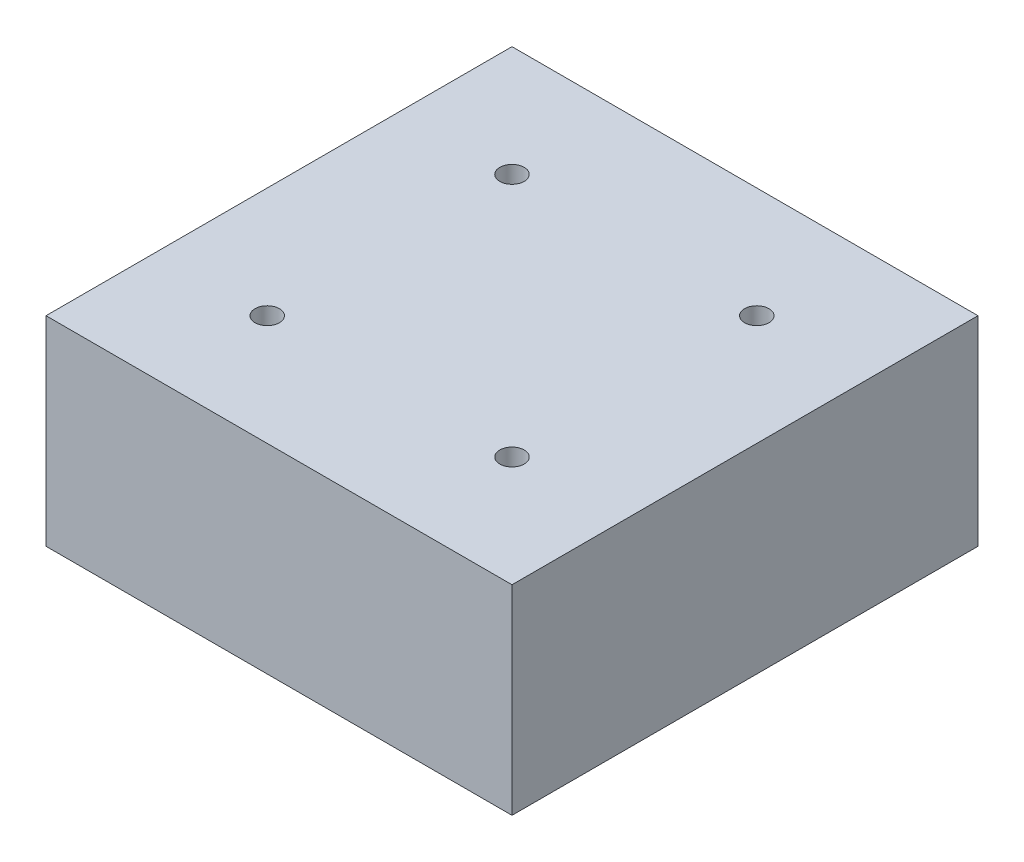
from build123d import *

# Parameters (mm, degrees)
F_01_HOUSING_PROFILE_W        = 210
F_01_HOUSING_PROFILE_H        = 210
F_01_HOUSING_PROFILE_R        = 5.5
F_01_HOUSING_BLOCK_DEPTH      = 90
F_02_FACE_BOSS_PROFILE_R      = 72.5
F_02_FACE_LOCATING_BOSS_DEPTH = 90


with BuildPart() as part:
    # 01_Housing_Profile → 01_Housing_Block (new body)
    with BuildSketch(Plane(origin=(0, 0, 0), x_dir=(1, 0, 0), z_dir=(0, 1, 0))):
        Rectangle(F_01_HOUSING_PROFILE_W, F_01_HOUSING_PROFILE_H)
        with Locations((55.154328933, 55.154328933)):
            Circle(F_01_HOUSING_PROFILE_R, mode=Mode.SUBTRACT)
        with Locations((-55.154328933, 55.154328933)):
            Circle(F_01_HOUSING_PROFILE_R, mode=Mode.SUBTRACT)
        with Locations((-55.154328933, -55.154328933)):
            Circle(F_01_HOUSING_PROFILE_R, mode=Mode.SUBTRACT)
        with Locations((55.154328933, -55.154328933)):
            Circle(F_01_HOUSING_PROFILE_R, mode=Mode.SUBTRACT)
    extrude(amount=F_01_HOUSING_BLOCK_DEPTH)

    # 02_Face_Boss_Profile → 02_Face_Locating_Boss (add)
    with BuildSketch(Plane(origin=(0, 0, 0), x_dir=(1, 0, 0), z_dir=(0, 1, 0))):
        Circle(F_02_FACE_BOSS_PROFILE_R)
    extrude(amount=F_02_FACE_LOCATING_BOSS_DEPTH)


solid = part.part
